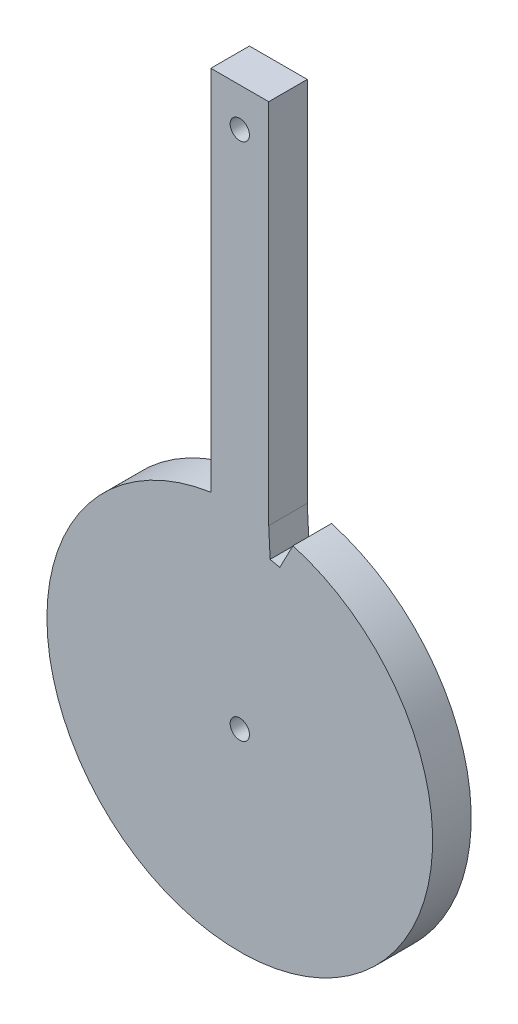
from build123d import *

# Parameters (mm, degrees)
BASE_FLANGE1_DEPTH = 10
CUT_EXTRUDE1_REACH = 155.346
SKETCH7_R          = 2.5
CUT_EXTRUDE2_REACH = 155.346


# Sheet-metal steps are written as plain solids
with BuildPart() as part:
    # Sketch2 → Base-Flange1 (new body)
    with BuildSketch(Plane.XY):
        with BuildLine():
            Line((7.5, 49.434299833), (7.5, 144.62))
            Line((7.5, 144.62), (-7.5, 144.62))
            Line((-7.5, 144.62), (-7.5, 49.434299833))
            ThreePointArc((-7.5, 49.434299833), (0, -50), (7.5, 49.434299833))
        make_face()
    extrude(amount=-BASE_FLANGE1_DEPTH)

    # Sketch7 → Cut-Extrude1 (cut, up to next)
    with BuildSketch(Plane.XY, mode=Mode.PRIVATE) as cut_extrude1_sk1:
        with Locations((0, 134.62)):
            Circle(SKETCH7_R)
    cut_extrude1_tool1 = extrude(cut_extrude1_sk1.sketch, amount=-CUT_EXTRUDE1_REACH, mode=Mode.PRIVATE) & part.part
    # Sketch7 → Cut-Extrude1 (cut, up to next)
    with BuildSketch(Plane.XY, mode=Mode.PRIVATE) as cut_extrude1_sk2:
        Circle(SKETCH7_R)
    cut_extrude1_tool2 = extrude(cut_extrude1_sk2.sketch, amount=-CUT_EXTRUDE1_REACH, mode=Mode.PRIVATE) & part.part
    add(cut_extrude1_tool1.solids().sort_by_distance((0, 134.62, 0))[0], mode=Mode.SUBTRACT)
    add(cut_extrude1_tool2.solids().sort_by_distance((0, 0, 0))[0], mode=Mode.SUBTRACT)

    # Sketch8 → Cut-Extrude2 (cut, up to next)
    with BuildSketch(Plane.XY, mode=Mode.PRIVATE) as cut_extrude2_sk1:
        with BuildLine():
            Line((7.5, 49.434299833), (7.871687465, 42.043640294))
            Line((7.871687465, 42.043640294), (10.372740004, 41.497438686))
            Line((10.372740004, 41.497438686), (13.791710294, 48.060261414))
            ThreePointArc((13.791710294, 48.060261414), (10.66800015, 48.848682406), (7.5, 49.434299833))
        make_face()
    cut_extrude2_tool1 = extrude(cut_extrude2_sk1.sketch, amount=-CUT_EXTRUDE2_REACH, mode=Mode.PRIVATE) & part.part
    add(cut_extrude2_tool1.solids().sort_by_distance((10.002556, 45.80162, 0))[0], mode=Mode.SUBTRACT)


solid = part.part
